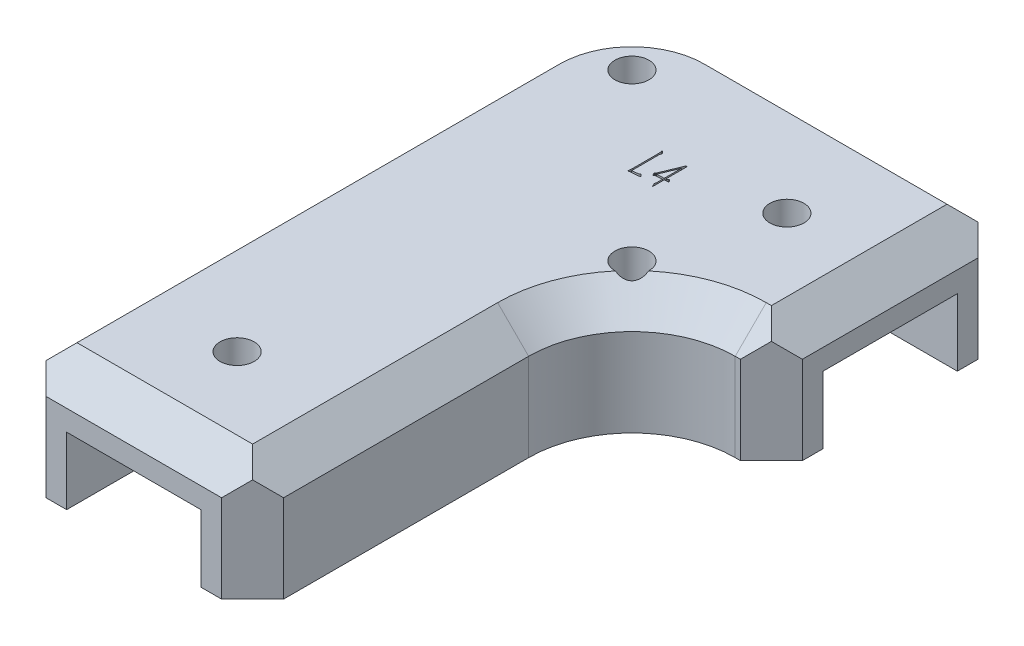
from build123d import *

# Parameters (mm, degrees)
SKETCH_1_W          = 23
SKETCH_1_H          = 23
SKETCH_1_W_2        = 13
SKETCH_1_H_2        = 13
EXTRUDE_1_DEPTH     = 59.72
SKETCH_2_R          = 1.65
CUT_EXTRUDE_1_DEPTH = 34
SKETCH_4_W          = 23
SKETCH_4_H          = 23
SKETCH_4_R          = 3
EXTRUDE_2_DEPTH     = 3.5
SKETCH_5_W          = 23
SKETCH_5_H          = 23
SKETCH_5_W_2        = 13
SKETCH_5_H_2        = 13
EXTRUDE_1_2_DEPTH   = 10
SKETCH_6_R          = 1.65
CUT_EXTRUDE_2_DEPTH = 39
SKETCH_7_W          = 13
SKETCH_7_H          = 13
CUT_EXTRUDE_3_DEPTH = 13
CHAMFER_1_SIZE      = 3
SKETCH_8_W          = 36.5
SKETCH_8_H          = 59.72
CUT_EXTRUDE_4_DEPTH = 11.5
EXTRUDE_3_DEPTH     = 6.5
FILLET_1_R          = 10
FILLET_2_R          = 10
SKETCH_10_R         = 1.65
CUT_EXTRUDE_5_DEPTH = 28.5
CHAMFER_3_SIZE      = 3
CHAMFER_4_SIZE      = 3
CHAMFER_5_SIZE      = 3
CUT_EXTRUDE_6_DEPTH = 0.3


with BuildPart() as part:
    # 草图1 → Extrude 1 (new body)
    with BuildSketch(Plane.XY):
        with Locations((6.5, 6.5)):
            Rectangle(SKETCH_1_W, SKETCH_1_H)
        with Locations((6.5, 6.5)):
            Rectangle(SKETCH_1_W_2, SKETCH_1_H_2, mode=Mode.SUBTRACT)
    extrude(amount=EXTRUDE_1_DEPTH)

    # 草图2 → 切除-拉伸1 (cut)
    with BuildSketch(Plane.XZ.offset(5)):
        with Locations(Location((6.5, 49.72, 0), (0, 0, 270))):
            Circle(SKETCH_2_R)
    extrude(amount=-CUT_EXTRUDE_1_DEPTH, mode=Mode.SUBTRACT)

    # 草图4 → 凸台-拉伸2 (add)
    with BuildSketch(Plane(origin=(18, 0, 0), x_dir=(0, 0, -1), z_dir=(1, 0, 0))):
        with Locations((-11.5, 6.5)):
            Rectangle(SKETCH_4_W, SKETCH_4_H)
        with Locations(Location((-11.5, 6.5, 0), (0, 0, 90))):
            Circle(SKETCH_4_R, mode=Mode.SUBTRACT)
    extrude(amount=EXTRUDE_2_DEPTH)

    # 草图5 → Extrude 1 2 (add)
    with BuildSketch(Plane(origin=(21.5, 0, 0), x_dir=(0, 0, -1), z_dir=(1, 0, 0))):
        with Locations((-11.5, 6.5)):
            Rectangle(SKETCH_5_W, SKETCH_5_H)
        with Locations((-11.5, 6.5)):
            Rectangle(SKETCH_5_W_2, SKETCH_5_H_2, mode=Mode.SUBTRACT)
    extrude(amount=EXTRUDE_1_2_DEPTH)

    # 草图6 → 切除-拉伸2 (cut)
    with BuildSketch(Plane(origin=(0, 18, 0), x_dir=(1, 0, 0), z_dir=(0, 1, 0))):
        with Locations(Location((21.5, -11.5, 0), (0, 0, 270))):
            Circle(SKETCH_6_R)
    extrude(amount=-CUT_EXTRUDE_2_DEPTH, mode=Mode.SUBTRACT)

    # 草图7 → 切除-拉伸3 (cut)
    with BuildSketch(Plane(origin=(21.5, 0, 0), x_dir=(0, 0, -1), z_dir=(1, 0, 0))):
        with Locations((-11.5, 6.5)):
            Rectangle(SKETCH_7_W, SKETCH_7_H)
    extrude(amount=-CUT_EXTRUDE_3_DEPTH, mode=Mode.SUBTRACT)

    # 倒角1
    chamfer_1_edges = [part.edges().sort_by_distance(p)[0] for p in [
        (13, 6.5, 18),
    ]]
    chamfer(chamfer_1_edges, length=CHAMFER_1_SIZE)

    # 草图8 → 切除-拉伸4 (cut)
    with BuildSketch(Plane.XZ.offset(5)):
        with Locations((13.25, 29.86)):
            Rectangle(SKETCH_8_W, SKETCH_8_H)
    extrude(amount=-CUT_EXTRUDE_4_DEPTH, mode=Mode.SUBTRACT)

    # 草图9 → 凸台-拉伸3 (add)
    with BuildSketch(Plane.XZ.offset(-13)):
        Polygon((13, 5), (0, 18), (0, 0), (13, 0), align=None)
    extrude(amount=EXTRUDE_3_DEPTH)

    # 圆角1
    fillet_1_edges = [part.edges().sort_by_distance(p)[0] for p in [
        (-5, 12.25, 0),
    ]]
    fillet(fillet_1_edges, radius=FILLET_1_R)

    # 圆角2
    fillet_2_edges = [part.edges().sort_by_distance(p)[0] for p in [
        (18, 12.25, 23),
    ]]
    fillet(fillet_2_edges, radius=FILLET_2_R)

    # 草图10 → 切除-拉伸5 (cut)
    with BuildSketch(Plane.XZ.offset(-6.5)):
        with Locations(Location((2, 7, 0), (0, 0, 270))):
            Circle(SKETCH_10_R)
        with Locations(Location((18, 23, 0), (0, 0, 270))):
            Circle(SKETCH_10_R)
    extrude(amount=-CUT_EXTRUDE_5_DEPTH, mode=Mode.SUBTRACT)

    # 倒角3
    # the kernel refuses this chamfer: 3 mm, written as the material it takes off along each edge
    with BuildSketch(Plane(origin=(5, 18, 10), x_dir=(0, 0, -1), z_dir=(1, 0, 0))) as chamfer_3_piece_1:
        Polygon((10 - CHAMFER_3_SIZE, 0), (10, -CHAMFER_3_SIZE), (10, 0), align=None)
    revolve(axis=Axis((5, 18, 10), (0, 1, 0)), revolution_arc=90, mode=Mode.SUBTRACT)
    with BuildSketch(Plane(origin=(28, 18, 33), x_dir=(-1, 0, 0), z_dir=(0, 0, 1))) as chamfer_3_piece_2:
        Polygon((10 + CHAMFER_3_SIZE, 0), (10, CHAMFER_3_SIZE), (10, 0), align=None)
    revolve(axis=Axis((28, 18, 33), (0, -1, 0)), revolution_arc=90, mode=Mode.SUBTRACT)
    with BuildSketch(Plane(origin=(28, 18, 23), x_dir=(0, 0.027495876610586768, -0.9996219169112968), z_dir=(1, 0, 0))) as chamfer_3_piece_3:
        Polygon((CHAMFER_3_SIZE * 0.999621916911, -CHAMFER_3_SIZE * 0.0274958766106), (-CHAMFER_3_SIZE * 0.0274958766106, -CHAMFER_3_SIZE * 0.999621916911), (0, 0), align=None)
    extrude(amount=11.215048964, mode=Mode.SUBTRACT)
    with BuildSketch(Plane(origin=(39.215048964, 18, 0), x_dir=(0, 0.027495876610586778, 0.9996219169112968), z_dir=(-1, 0, 0))) as chamfer_3_piece_4:
        Polygon((CHAMFER_3_SIZE * 0.999621916911, -CHAMFER_3_SIZE * 0.0274958766106), (-CHAMFER_3_SIZE * 0.0274958766106, -CHAMFER_3_SIZE * 0.999621916911), (0, 0), align=None)
    extrude(amount=34.215048964, mode=Mode.SUBTRACT)
    with BuildSketch(Plane(origin=(-5, 18, 10), x_dir=(0.9996219169112968, 0.027495876610586778, 0), z_dir=(0, 0, 1))) as chamfer_3_piece_5:
        Polygon((CHAMFER_3_SIZE * 0.999621916911, -CHAMFER_3_SIZE * 0.0274958766106), (-CHAMFER_3_SIZE * 0.0274958766106, -CHAMFER_3_SIZE * 0.999621916911), (0, 0), align=None)
    extrude(amount=57.435048964, mode=Mode.SUBTRACT)
    with BuildSketch(Plane(origin=(18, 18, 33), x_dir=(-0.9996219169112968, 0.02749587661058678, 0), z_dir=(0, 0, 1))) as chamfer_3_piece_6:
        Polygon((CHAMFER_3_SIZE * 0.999621916911, CHAMFER_3_SIZE * 0.0274958766106), (-CHAMFER_3_SIZE * 0.0274958766106, CHAMFER_3_SIZE * 0.999621916911), (0, 0), align=None)
    extrude(amount=34.435048964, mode=Mode.SUBTRACT)

    # 倒角4
    chamfer_4_edges = [part.edges().sort_by_distance(p)[0] for p in [
        (31.5, 18, 11.5),
        (6.5, 18, 59.72),
    ]]
    chamfer(chamfer_4_edges, length=CHAMFER_4_SIZE)

    # 倒角5
    chamfer_5_edges = [part.edges().sort_by_distance(p)[0] for p in [
        (31.5, 10.75, 0),
        (18, 10.75, 59.72),
        (-5, 10.75, 59.72),
        (31.5, 10.75, 23),
    ]]
    chamfer(chamfer_5_edges, length=CHAMFER_5_SIZE)

    # 草图11 → 切除-拉伸6 (cut)
    # profile 1 of 2: a face of its own
    with BuildSketch(Plane(origin=(0, 18, 0), x_dir=(1, 0, 0), z_dir=(0, 1, 0))):
        with BuildLine():
            Line((10.237159209, -12.32483908), (10.272211414, -12.284566333))
            Line((10.272211414, -12.284566333), (10.493711521, -12.561255018))
            add(Edge.make_bspline(
                [(10.493711521, -12.561255018), (10.487309741, -12.57321708), (10.474664974, -12.596844492), (10.453766643, -12.633245036), (10.437383484, -12.678803736), (10.42678589, -12.736107023), (10.41929345, -12.804438747), (10.418698455, -12.853332822), (10.418386569, -12.878962242)],
                knots=[0, 0, 0, 0, 0.736410598, 1.454555069, 2.274010016, 3.348139226, 4.609940921, 6, 6, 6, 6], degree=3))
            Line((10.418386569, -12.878962242), (10.418386569, -15.445976945))
            add(Edge.make_bspline(
                [(10.418386569, -15.445976945), (10.439024116, -15.446197463), (10.476825383, -15.44660138), (10.527504836, -15.444164634), (10.567096144, -15.444382267), (10.599440912, -15.441684851), (10.633925707, -15.437068289), (10.678646108, -15.43114223), (10.738403056, -15.423897132), (10.807978822, -15.413933144), (10.878573878, -15.403442161), (10.940268165, -15.393999697), (10.988224608, -15.385574298), (11.03333546, -15.377768735), (11.077634294, -15.362395951), (11.116507962, -15.334038018), (11.141501488, -15.3052678), (11.160956228, -15.297943801), (11.167907131, -15.29532704)],
                knots=[0, 0, 0, 0, 1.271684107, 2.329311289, 3.126176351, 3.710204741, 4.32783396, 5.270448411, 6.49050515, 8.03759688, 9.602040843, 10.889228832, 11.884182716, 12.602334394, 13.712376462, 14.732953672, 15.547302315, 16, 16, 16, 16], degree=3))
            add(Edge.make_bspline(
                [(11.167907131, -15.29532704), (11.171157256, -15.297790165), (11.180598208, -15.304945044), (11.199465358, -15.321199607), (11.23074612, -15.346977294), (11.268675777, -15.383728766), (11.307606698, -15.419746285), (11.338574425, -15.448367363), (11.360816593, -15.468783286), (11.369429212, -15.489923279), (11.373022107, -15.507004685), (11.374056065, -15.517065759), (11.374491406, -15.521301897)],
                knots=[0, 0, 0, 0, 0.390394386, 1.134016561, 2.38360509, 4.269889804, 6.18981564, 7.453157385, 8.329021544, 9.032311711, 9.592562279, 10, 10, 10, 10], degree=3))
            add(Edge.make_bspline(
                [(11.374491406, -15.521301897), (11.37240974, -15.526097769), (11.368224433, -15.535740147), (11.353436868, -15.545092844), (11.334328563, -15.550059783), (11.301085761, -15.549499), (11.253456452, -15.547924897), (11.1916752, -15.557511576), (11.12536294, -15.566709384), (11.072725012, -15.574940209), (11.032733497, -15.580748142), (11.003569508, -15.583319798), (10.966840315, -15.587442615), (10.922278163, -15.590745604), (10.870087153, -15.595374751), (10.810170985, -15.600549317), (10.742588839, -15.606698877), (10.694831886, -15.610362116), (10.669718339, -15.612288472)],
                knots=[0, 0, 0, 0, 0.341365878, 0.68633572, 1.116730632, 1.647491765, 2.890856209, 4.29325764, 5.800779701, 7.359923239, 7.845242571, 8.495183841, 9.311733456, 10.309872826, 11.474601469, 12.805924266, 14.320358265, 16, 16, 16, 16], degree=3))
            Line((10.669718339, -15.612288472), (10.458659315, -15.632424846))
            Line((10.458659315, -15.632424846), (10.342315825, -15.642120137))
            add(Edge.make_bspline(
                [(10.342315825, -15.642120137), (10.330205012, -15.646066226), (10.310576231, -15.652461909), (10.28162952, -15.648341606), (10.269064193, -15.631583459), (10.259329157, -15.613202207), (10.260064065, -15.584545017), (10.265458776, -15.544786876), (10.272435293, -15.490061402), (10.275652028, -15.448717521), (10.277431955, -15.425840571)],
                knots=[0, 0, 0, 0, 1.058270145, 1.715207142, 2.242218181, 2.723015089, 3.427046488, 4.550153686, 6.091084828, 8, 8, 8, 8], degree=3))
            Line((10.277431955, -15.425840571), (10.287127246, -15.129015513))
            Line((10.287127246, -15.129015513), (10.287127246, -12.863300618))
            add(Edge.make_bspline(
                [(10.287127246, -12.863300618), (10.287232845, -12.835208092), (10.287422554, -12.784739607), (10.286319057, -12.717874585), (10.286118094, -12.668130177), (10.283854663, -12.623640485), (10.281146263, -12.576386479), (10.277055063, -12.517791845), (10.267701437, -12.449509467), (10.254241067, -12.401757484), (10.2468545, -12.375552909)],
                knots=[0, 0, 0, 0, 1.372323329, 2.465391677, 3.267017655, 3.801925377, 4.641299591, 5.579257235, 6.671583216, 8, 8, 8, 8], degree=3))
            Line((10.2468545, -12.375552909), (10.237159209, -12.32483908))
        make_face()
    # profile 2 of 2: a face of its own
    with BuildSketch(Plane(origin=(0, 18, 0), x_dir=(1, 0, 0), z_dir=(0, 1, 0))):
        with BuildLine():
            Line((12.632641842, -14.680794758), (11.922648235, -14.721067505))
            Line((11.922648235, -14.721067505), (11.872680197, -14.796392457))
            add(Edge.make_bspline(
                [(11.872680197, -14.796392457), (11.8694195, -14.804285956), (11.864491576, -14.816215479), (11.846271787, -14.82851828), (11.832603325, -14.810870961), (11.826144402, -14.799362255), (11.821966368, -14.791917707)],
                knots=[0, 0, 0, 0, 1.282902353, 1.938863145, 2.666728425, 4, 4, 4, 4], degree=3))
            Line((11.821966368, -14.791917707), (11.726505043, -14.600249265))
            add(Edge.make_bspline(
                [(11.726505043, -14.600249265), (11.722421253, -14.588930913), (11.715687127, -14.570267068), (11.710784433, -14.54521565), (11.712178398, -14.527547303), (11.71541385, -14.518420775), (11.716809752, -14.514483231)],
                knots=[0, 0, 0, 0, 1.63130738, 2.690008936, 3.434818089, 4, 4, 4, 4], degree=3))
            Line((11.716809752, -14.514483231), (11.757082499, -14.50478794))
            Line((11.757082499, -14.50478794), (11.812271077, -14.474210484))
            Line((11.812271077, -14.474210484), (12.663219298, -12.420300405))
            Line((12.663219298, -12.420300405), (12.773596456, -12.420300405))
            Line((12.773596456, -12.420300405), (12.773596456, -14.494346857))
            add(Edge.make_bspline(
                [(12.773596456, -14.494346857), (12.783968002, -14.49442549), (12.801603574, -14.494559195), (12.817685995, -14.487541945), (12.824310285, -14.484651566)],
                knots=[0, 0, 0, 0, 1.176207474, 2, 2, 2, 2], degree=3))
            Line((12.824310285, -14.484651566), (12.899635237, -14.454074111))
            add(Edge.make_bspline(
                [(12.899635237, -14.454074111), (12.909372882, -14.45043977), (12.926729924, -14.443961672), (12.949079362, -14.434232754), (12.964900623, -14.426741929), (12.972272578, -14.421084462), (12.974960189, -14.419021905)],
                knots=[0, 0, 0, 0, 1.495147538, 2.665053038, 3.513315187, 4, 4, 4, 4], degree=3))
            Line((12.974960189, -14.419021905), (13.010012394, -14.389190241))
            Line((13.010012394, -14.389190241), (13.150967008, -14.534619604))
            add(Edge.make_bspline(
                [(13.150967008, -14.534619604), (13.158147754, -14.543261129), (13.169902345, -14.557406954), (13.175032726, -14.581345927), (13.170140153, -14.59753514), (13.16099412, -14.609193669), (13.145051649, -14.61408062), (13.133316768, -14.61476132), (13.126355885, -14.615165097)],
                knots=[0, 0, 0, 0, 1.690587597, 2.767423091, 3.557953073, 4.202677464, 4.933866242, 6, 6, 6, 6], degree=3))
            Line((13.126355885, -14.615165097), (12.773596456, -14.655437844))
            Line((12.773596456, -14.655437844), (12.773596456, -15.557099894))
            add(Edge.make_bspline(
                [(12.773596456, -15.557099894), (12.773578503, -15.559834814), (12.773518084, -15.569038872), (12.77467652, -15.588414589), (12.77514626, -15.619244646), (12.775750734, -15.657554868), (12.776785958, -15.695996276), (12.77645149, -15.727131786), (12.77443333, -15.746766153), (12.769686653, -15.759384491), (12.760395185, -15.761643892), (12.755626049, -15.759456885), (12.753460082, -15.758463627)],
                knots=[0, 0, 0, 0, 0.375701713, 1.264380521, 2.665139726, 4.612257271, 6.525225464, 7.960129458, 8.858599367, 9.286556546, 9.675980055, 10, 10, 10, 10], degree=3))
            add(Edge.make_bspline(
                [(12.753460082, -15.758463627), (12.749249226, -15.755960749), (12.736555449, -15.748415734), (12.725430289, -15.724067152), (12.712062685, -15.69879476), (12.706053313, -15.680496526), (12.703492045, -15.672697592)],
                knots=[0, 0, 0, 0, 0.572299195, 1.725216547, 3.030459198, 4, 4, 4, 4], degree=3))
            Line((12.703492045, -15.672697592), (12.657998757, -15.581711017))
            Line((12.657998757, -15.581711017), (12.632641842, -15.511606606))
            add(Edge.make_bspline(
                [(12.632641842, -15.511606606), (12.628785774, -15.503205626), (12.621808143, -15.488003888), (12.614164578, -15.467049314), (12.607340053, -15.451579242), (12.603541019, -15.433174575), (12.6079974, -15.404423208), (12.617819006, -15.364159555), (12.629614236, -15.321116662), (12.635156078, -15.28178508), (12.63743117, -15.247878072), (12.637716587, -15.22597172), (12.637862384, -15.214781547)],
                knots=[0, 0, 0, 0, 0.908031708, 1.643101311, 2.192199313, 2.565975908, 3.473020803, 5.002279505, 6.661670863, 7.846934984, 8.900174221, 10, 10, 10, 10], degree=3))
            Line((12.637862384, -15.214781547), (12.632641842, -14.680794758))
        make_face()
        Polygon((12.637862384, -14.514483231), (12.637862384, -12.843164245), (11.927868776, -14.550281228), align=None, mode=Mode.SUBTRACT)
    extrude(amount=-CUT_EXTRUDE_6_DEPTH, mode=Mode.SUBTRACT)


solid = part.part
